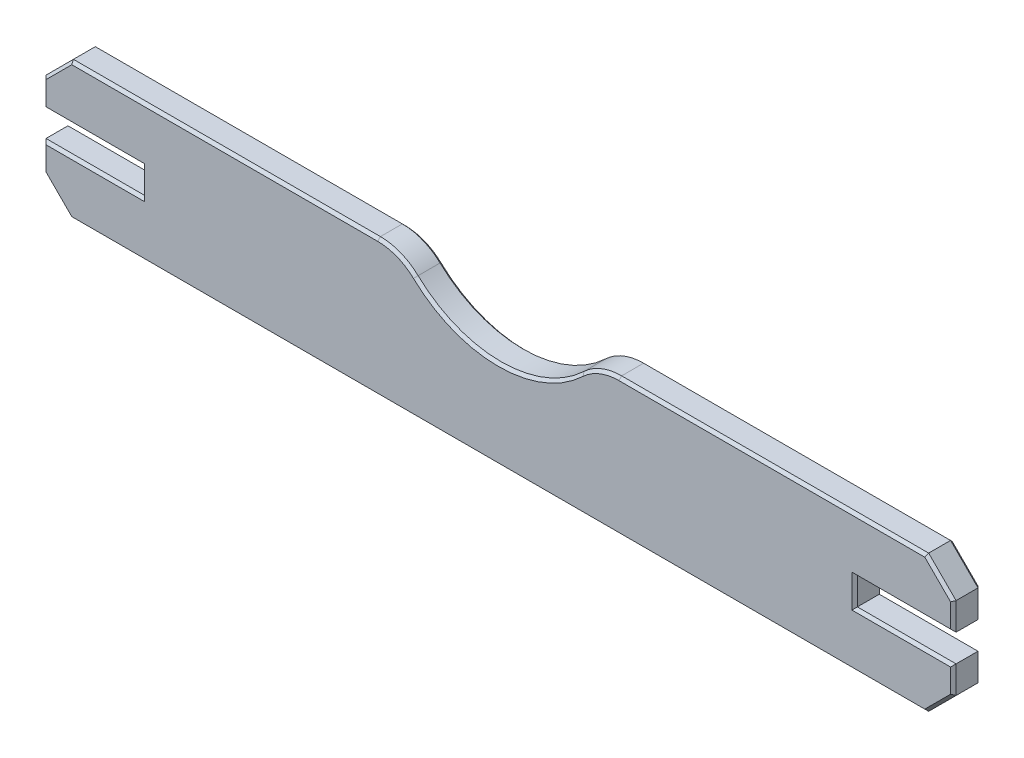
from build123d import *

# Parameters (mm, degrees)
BOSS_EXTRUDE1_DEPTH = 5
CHAMFER1_SIZE       = 0.5


with BuildPart() as part:
    # Sketch1 → Boss-Extrude1 (new body)
    with BuildSketch(Plane.XY):
        with BuildLine():
            Line((-65, -2.5), (-65, 2.5))
            Line((-65, 2.5), (-83, 2.5))
            Line((-83, 2.5), (-83, 7.5))
            Line((-83, 7.5), (-78, 12.5))
            Line((-78, 12.5), (-22, 12.5))
            ThreePointArc((-22, 12.5), (-18.299894443, 11.7902755), (-15.125, 9.761843774))
            ThreePointArc((-15.125, 9.761843774), (0, 3.737900077), (15.125, 9.761843774))
            ThreePointArc((15.125, 9.761843774), (18.299894443, 11.7902755), (22, 12.5))
            Line((22, 12.5), (78, 12.5))
            Line((78, 12.5), (83, 7.5))
            Line((83, 7.5), (83, 2.5))
            Line((83, 2.5), (65, 2.5))
            Line((65, 2.5), (65, -2.5))
            Line((65, -2.5), (83, -2.5))
            Line((83, -2.5), (83, -7.5))
            Line((83, -7.5), (78, -12.5))
            Line((78, -12.5), (-78, -12.5))
            Line((-78, -12.5), (-83, -7.5))
            Line((-83, -7.5), (-83, -2.5))
            Line((-83, -2.5), (-65, -2.5))
        make_face()
    extrude(amount=BOSS_EXTRUDE1_DEPTH)

    # Chamfer1
    chamfer1_edges = [part.edges().sort_by_distance(p)[0] for p in [
        (-18.299894443, 11.7902755, 0),
        (-50, 12.5, 0),
        (-80.5, 10, 0),
        (-83, 5, 0),
        (-74, 2.5, 0),
        (-65, 0, 0),
        (-74, -2.5, 0),
        (-83, -5, 0),
        (-80.5, -10, 0),
        (0, -12.5, 0),
        (80.5, -10, 0),
        (83, -5, 0),
        (74, -2.5, 0),
        (65, 0, 0),
        (74, 2.5, 0),
        (83, 5, 0),
        (80.5, 10, 0),
        (50, 12.5, 0),
        (18.299894443, 11.7902755, 0),
        (0, 3.737900077, 0),
        (18.299894443, 11.7902755, 5),
        (50, 12.5, 5),
        (80.5, 10, 5),
        (83, 5, 5),
        (74, 2.5, 5),
        (65, 0, 5),
        (74, -2.5, 5),
        (83, -5, 5),
        (80.5, -10, 5),
        (0, -12.5, 5),
        (-80.5, -10, 5),
        (-83, -5, 5),
        (-74, -2.5, 5),
        (-65, 0, 5),
        (-74, 2.5, 5),
        (-83, 5, 5),
        (-80.5, 10, 5),
        (-50, 12.5, 5),
        (-18.299894443, 11.7902755, 5),
        (0, 3.737900077, 5),
    ]]
    chamfer(chamfer1_edges, length=CHAMFER1_SIZE)


solid = part.part
